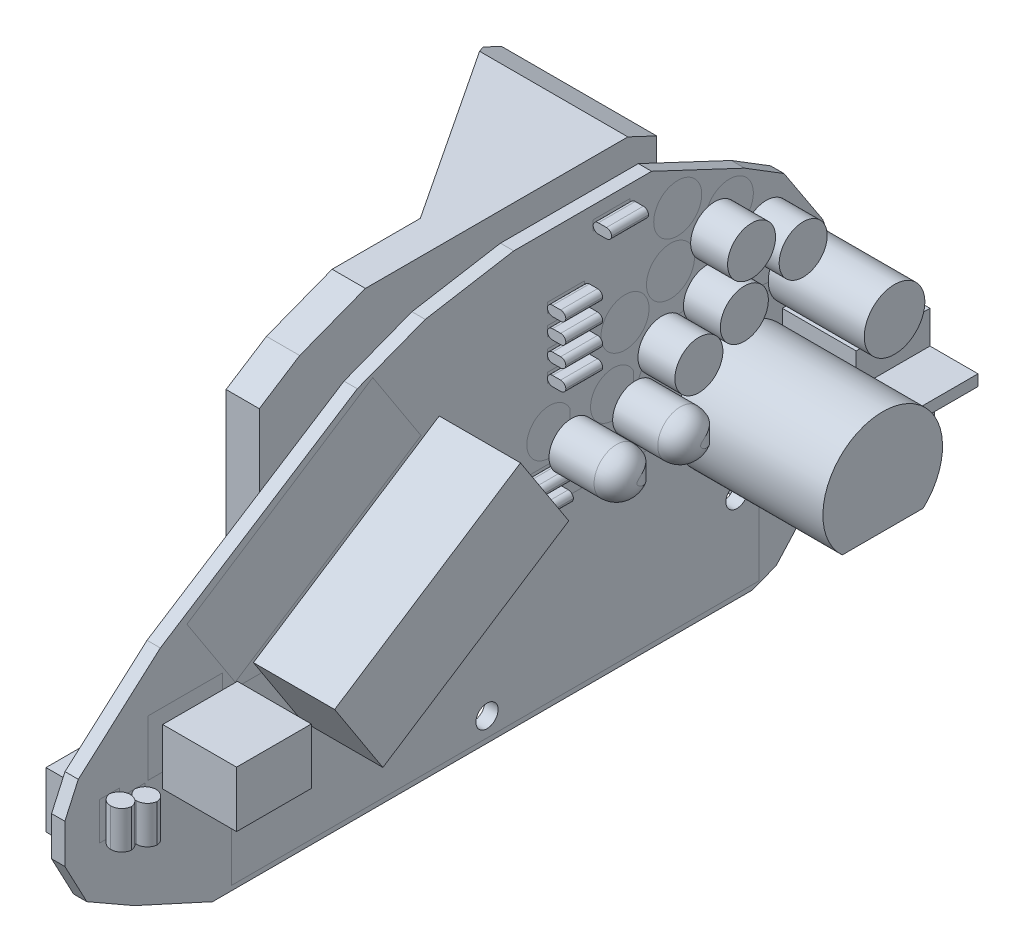
from build123d import *

# Parameters (mm, degrees)
SALIENTE_EXTRUIR1_DEPTH    = 0.9
SALIENTE_EXTRUIR2_START    = 2
CROQUIS7_W                 = 10.12
CROQUIS7_H                 = 7.56
SALIENTE_EXTRUIR2_DEPTH    = 10
SALIENTE_EXTRUIR2_2_DEPTH  = 10
SALIENTE_EXTRUIR3_START    = 9
SALIENTE_EXTRUIR3_DEPTH    = 11
SALIENTE_EXTRUIR4_START    = 5.5
SALIENTE_EXTRUIR4_DEPTH    = 20
SALIENTE_EXTRUIR5_START    = 5
CROQUIS10_R                = 3.25
SALIENTE_EXTRUIR5_DEPTH    = 5
SALIENTE_EXTRUIR5_2_DEPTH  = 5
SALIENTE_EXTRUIR5_3_DEPTH  = 5
SALIENTE_EXTRUIR5_4_DEPTH  = 5
CROQUIS11_W                = 5.2
CROQUIS11_H                = 2.65
SALIENTE_EXTRUIR6_DEPTH    = 3
CROQUIS11_W_2              = 2.66
CROQUIS11_H_2              = 5.11
SALIENTE_EXTRUIR6_2_DEPTH  = 3
SALIENTE_EXTRUIR6_3_DEPTH  = 3
REDONDEO1_R                = 1.5
REDONDEO2_R                = 1.5
REDONDEO3_R                = 1.5
CROQUIS12_W                = 5
CROQUIS12_H                = 1.33
SALIENTE_EXTRUIR7_DEPTH    = 2.5
SALIENTE_EXTRUIR7_2_DEPTH  = 2.5
SALIENTE_EXTRUIR7_3_DEPTH  = 2.5
SALIENTE_EXTRUIR7_4_DEPTH  = 2.5
SALIENTE_EXTRUIR7_5_DEPTH  = 2.5
SALIENTE_EXTRUIR7_6_DEPTH  = 2.5
SALIENTE_EXTRUIR7_7_DEPTH  = 2.5
REDONDEO4_R                = 0.7
REDONDEO5_R                = 0.7
REDONDEO6_R                = 0.7
REDONDEO7_R                = 0.7
REDONDEO8_R                = 0.7
REDONDEO9_R                = 0.7
REDONDEO10_R               = 0.7
SALIENTE_EXTRUIR8_START    = 4
CROQUIS13_R                = 4.1
SALIENTE_EXTRUIR8_DEPTH    = 13
SALIENTE_EXTRUIR9_START    = 3
SALIENTE_EXTRUIR9_DEPTH    = 9
SALIENTE_EXTRUIR9_2_DEPTH  = 9
REDONDEO11_R               = 2.9
REDONDEO12_R               = 2.9
SALIENTE_EXTRUIR10_START   = 3
CROQUIS15_W                = 10
CROQUIS15_H                = 5.9310163
SALIENTE_EXTRUIR10_DEPTH   = 10
CROQUIS16_W                = 10
CROQUIS16_H                = 1.5
SALIENTE_EXTRUIR11_DEPTH   = 6.5
SALIENTE_EXTRUIR12_START   = 2
CROQUIS17_W                = 10.12
CROQUIS17_H                = 7.56
SALIENTE_EXTRUIR12_DEPTH   = 10
CROQUIS17_W_2              = 7.56
CROQUIS17_H_2              = 10.12
SALIENTE_EXTRUIR12_2_DEPTH = 10
SALIENTE_EXTRUIR13_START   = 6
SALIENTE_EXTRUIR13_DEPTH   = 21
CROQUIS19_W                = 51.3
CROQUIS19_H                = 26.88
CORTAR_EXTRUIR1_DEPTH      = 16.5
CORTAR_EXTRUIR2_REACH      = 98.673
CROQUIS21_R                = 1.5
CORTAR_EXTRUIR3_DEPTH      = 1.8


with BuildPart() as part:
    # Croquis4 → Saliente-Extruir1 (new, symmetric)
    with BuildSketch(Plane(origin=(0, 0, 0), x_dir=(0, 0, -1), z_dir=(1, 0, 0))):
        Polygon((-10.622695688, 4.854650468), (0, 0), (73, 0), (76.300834566, 1.236470537), (84.148906627, 9.961535881), (86.8383032, 17.509437242), (86.8383032, 26.919309348), (82.615525059, 38.695458453), (77.368769804, 46.703430489), (72.037005531, 49.99948888), (59.448219357, 55.926364448), (40.78111611, 55.926364448), (28.794561856, 53.88545149), (19.598698434, 50.347904825), (-7.071388362, 33.291671224), (-18.17778841, 23.445194147), (-19.997236925, 19.435512881), (-19.997236925, 14.133503054), (-17.020462883, 8.512686248), align=None)
    extrude(amount=SALIENTE_EXTRUIR1_DEPTH, both=True)

    # Croquis21 → Cortar-Extruir3 (cut)
    with BuildSketch(Plane(origin=(0.9, 0, 0), x_dir=(0, 0, -1), z_dir=(1, 0, 0))):
        with Locations((71.002182534, 12.113092523)):
            Circle(CROQUIS21_R)
        with Locations((37.156321619, 20.626460955)):
            Circle(CROQUIS21_R)
        with Locations((37.156321619, 3.210835321)):
            Circle(CROQUIS21_R)
    extrude(amount=-CORTAR_EXTRUIR3_DEPTH, mode=Mode.SUBTRACT)


with BuildPart() as body_2:
    # Croquis7 → Saliente-Extruir2 (new body)
    with BuildSketch(Plane(origin=(0.9, 0, 0), x_dir=(0, 0, -1), z_dir=(1, 0, 0)).offset(SALIENTE_EXTRUIR2_START)):
        with Locations((-3.691075077, 22.378139651)):
            Rectangle(CROQUIS7_W, CROQUIS7_H)
    extrude(amount=SALIENTE_EXTRUIR2_DEPTH)


with BuildPart() as body_3:
    # Croquis7 → Saliente-Extruir2 2 (new body)
    with BuildSketch(Plane(origin=(0.9, 0, 0), x_dir=(0, 0, -1), z_dir=(1, 0, 0)).offset(SALIENTE_EXTRUIR2_START)):
        with Locations((80.699165068, 23.307910616)):
            Rectangle(CROQUIS7_W, CROQUIS7_H)
    extrude(amount=SALIENTE_EXTRUIR2_2_DEPTH)


with BuildPart() as body_4:
    # Croquis8 → Saliente-Extruir3 (new body)
    with BuildSketch(Plane(origin=(0.9, 0, 0), x_dir=(0, 0, -1), z_dir=(1, 0, 0)).offset(SALIENTE_EXTRUIR3_START)):
        Polygon((21.690282535, 50.615120653), (-3.469834503, 34.275949602), (3.065833917, 24.211902787), (28.225950955, 40.551073837), align=None)
    extrude(amount=SALIENTE_EXTRUIR3_DEPTH)


with BuildPart() as body_5:
    # Croquis9 → Saliente-Extruir4 (new body)
    with BuildSketch(Plane(origin=(0.9, 0, 0), x_dir=(0, 0, -1), z_dir=(1, 0, 0)).offset(SALIENTE_EXTRUIR4_START)):
        with BuildLine():
            Line((59.765445925, 23.529371997), (70.71288421, 23.529371997))
            ThreePointArc((70.71288421, 23.529371997), (65.239165068, 37.6), (59.765445925, 23.529371997))
        make_face()
    extrude(amount=SALIENTE_EXTRUIR4_DEPTH)


with BuildPart() as body_6:
    # Croquis10 → Saliente-Extruir5 (new body)
    with BuildSketch(Plane(origin=(0.9, 0, 0), x_dir=(0, 0, -1), z_dir=(1, 0, 0)).offset(SALIENTE_EXTRUIR5_START)):
        with Locations((55.848753396, 40.009851024)):
            Circle(CROQUIS10_R)
    extrude(amount=SALIENTE_EXTRUIR5_DEPTH)


with BuildPart() as body_7:
    # Croquis10 → Saliente-Extruir5 2 (new body)
    with BuildSketch(Plane(origin=(0.9, 0, 0), x_dir=(0, 0, -1), z_dir=(1, 0, 0)).offset(SALIENTE_EXTRUIR5_START)):
        with Locations((62.005224797, 42.949748612)):
            Circle(CROQUIS10_R)
    extrude(amount=SALIENTE_EXTRUIR5_2_DEPTH)


with BuildPart() as body_8:
    # Croquis10 → Saliente-Extruir5 3 (new body)
    with BuildSketch(Plane(origin=(0.9, 0, 0), x_dir=(0, 0, -1), z_dir=(1, 0, 0)).offset(SALIENTE_EXTRUIR5_START)):
        with Locations((69.970361435, 46.502448257)):
            Circle(CROQUIS10_R)
    extrude(amount=SALIENTE_EXTRUIR5_3_DEPTH)


with BuildPart() as body_9:
    # Croquis10 → Saliente-Extruir5 4 (new body)
    with BuildSketch(Plane(origin=(0.9, 0, 0), x_dir=(0, 0, -1), z_dir=(1, 0, 0)).offset(SALIENTE_EXTRUIR5_START)):
        with Locations((62.9827607, 49.836310956)):
            Circle(CROQUIS10_R)
    extrude(amount=SALIENTE_EXTRUIR5_4_DEPTH)


with BuildPart() as body_10:
    # Croquis11 → Saliente-Extruir6 (new body)
    with BuildSketch(Plane(origin=(0.9, 0, 0), x_dir=(0, 0, -1), z_dir=(1, 0, 0))):
        with Locations((31.478780251, 25.968522268)):
            Rectangle(CROQUIS11_W, CROQUIS11_H)
    extrude(amount=SALIENTE_EXTRUIR6_DEPTH)

    # Redondeo3
    # the kernel refuses this fillet: 1.5 mm, written as the material it takes off along each edge
    with BuildSketch(Plane(origin=(0.9, 27.293522268, -37.828780251), x_dir=(1, 0, 0), z_dir=(0, 0, 1)), Plane(origin=(0.9, 24.643522268, -25.128780251), x_dir=(1, 0, 0), z_dir=(0, 0, -1))) as redondeo3_piece_1:
        with BuildLine():
            CenterArc((REDONDEO3_R, -REDONDEO3_R), REDONDEO3_R, 90, 90)
            Line((0, -REDONDEO3_R), (0, 0))
            Line((0, 0), (REDONDEO3_R, 0))
        make_face()
    extrude(amount=12.7, mode=Mode.SUBTRACT)
    with BuildSketch(Plane(origin=(3.9, 24.643522268, -25.128780251), x_dir=(-1, 0, 0), z_dir=(0, 0, -1)), Plane(origin=(3.9, 27.293522268, -37.828780251), x_dir=(-1, 0, 0), z_dir=(0, 0, 1))) as redondeo3_piece_2:
        with BuildLine():
            CenterArc((REDONDEO3_R, REDONDEO3_R), REDONDEO3_R, 180, 90)
            Line((0, REDONDEO3_R), (0, 0))
            Line((0, 0), (REDONDEO3_R, 0))
        make_face()
    extrude(amount=12.7, mode=Mode.SUBTRACT)


with BuildPart() as body_11:
    # Croquis11 → Saliente-Extruir6 2 (new body)
    with BuildSketch(Plane(origin=(0.9, 0, 0), x_dir=(0, 0, -1), z_dir=(1, 0, 0))):
        with Locations((-10.47860596, 15.944294372)):
            Rectangle(CROQUIS11_W_2, CROQUIS11_H_2)
    extrude(amount=SALIENTE_EXTRUIR6_2_DEPTH)

    # Redondeo2
    # the kernel refuses this fillet: 1.5 mm, written as the material it takes off along each edge
    with BuildSketch(Plane(origin=(0.9, 22.249294372, 11.80860596), x_dir=(1, 0, 0), z_dir=(0, -1, 0)), Plane(origin=(0.9, 9.639294372, 9.14860596), x_dir=(1, 0, 0), z_dir=(0, 1, 0))) as redondeo2_piece_1:
        with BuildLine():
            CenterArc((REDONDEO2_R, -REDONDEO2_R), REDONDEO2_R, 90, 90)
            Line((0, -REDONDEO2_R), (0, 0))
            Line((0, 0), (REDONDEO2_R, 0))
        make_face()
    extrude(amount=12.61, mode=Mode.SUBTRACT)
    with BuildSketch(Plane(origin=(3.9, 9.639294372, 9.14860596), x_dir=(-1, 0, 0), z_dir=(0, 1, 0)), Plane(origin=(3.9, 22.249294372, 11.80860596), x_dir=(-1, 0, 0), z_dir=(0, -1, 0))) as redondeo2_piece_2:
        with BuildLine():
            CenterArc((REDONDEO2_R, REDONDEO2_R), REDONDEO2_R, 180, 90)
            Line((0, REDONDEO2_R), (0, 0))
            Line((0, 0), (REDONDEO2_R, 0))
        make_face()
    extrude(amount=12.61, mode=Mode.SUBTRACT)


with BuildPart() as body_12:
    # Croquis11 → Saliente-Extruir6 3 (new body)
    with BuildSketch(Plane(origin=(0.9, 0, 0), x_dir=(0, 0, -1), z_dir=(1, 0, 0))):
        with Locations((-13.960747503, 17.082754592)):
            Rectangle(CROQUIS11_W_2, CROQUIS11_H_2)
    extrude(amount=SALIENTE_EXTRUIR6_3_DEPTH)

    # Redondeo1
    # the kernel refuses this fillet: 1.5 mm, written as the material it takes off along each edge
    with BuildSketch(Plane(origin=(3.9, 10.777754592, 12.630747503), x_dir=(-1, 0, 0), z_dir=(0, 1, 0)), Plane(origin=(3.9, 23.387754592, 15.290747503), x_dir=(-1, 0, 0), z_dir=(0, -1, 0))) as redondeo1_piece_1:
        with BuildLine():
            CenterArc((REDONDEO1_R, REDONDEO1_R), REDONDEO1_R, 180, 90)
            Line((0, REDONDEO1_R), (0, 0))
            Line((0, 0), (REDONDEO1_R, 0))
        make_face()
    extrude(amount=12.61, mode=Mode.SUBTRACT)
    with BuildSketch(Plane(origin=(0.9, 10.777754592, 12.630747503), x_dir=(1, 0, 0), z_dir=(0, 1, 0)), Plane(origin=(0.9, 23.387754592, 15.290747503), x_dir=(1, 0, 0), z_dir=(0, -1, 0))) as redondeo1_piece_2:
        with BuildLine():
            CenterArc((REDONDEO1_R, -REDONDEO1_R), REDONDEO1_R, 90, 90)
            Line((0, -REDONDEO1_R), (0, 0))
            Line((0, 0), (REDONDEO1_R, 0))
        make_face()
    extrude(amount=12.61, mode=Mode.SUBTRACT)


with BuildPart() as body_13:
    # Croquis12 → Saliente-Extruir7 (new body)
    with BuildSketch(Plane(origin=(0.9, 0, 0), x_dir=(0, 0, -1), z_dir=(1, 0, 0))):
        with Locations((43.860652231, 25.354371997)):
            Rectangle(CROQUIS12_W, CROQUIS12_H)
    extrude(amount=SALIENTE_EXTRUIR7_DEPTH)

    # Redondeo5
    # the kernel refuses this fillet: 0.7 mm, written as the material it takes off along each edge
    with BuildSketch(Plane(origin=(0.9, 24.689371997, -39.610652231), x_dir=(1, 0, 0), z_dir=(0, 0, -1)), Plane(origin=(0.9, 26.019371997, -48.110652231), x_dir=(1, 0, 0), z_dir=(0, 0, 1))) as redondeo5_piece_1:
        with BuildLine():
            CenterArc((REDONDEO5_R, -REDONDEO5_R), REDONDEO5_R, 90, 90)
            Line((0, -REDONDEO5_R), (0, 0))
            Line((0, 0), (REDONDEO5_R, 0))
        make_face()
    extrude(amount=8.5, mode=Mode.SUBTRACT)
    with BuildSketch(Plane(origin=(3.4, 24.689371997, -39.610652231), x_dir=(-1, 0, 0), z_dir=(0, 0, -1)), Plane(origin=(3.4, 26.019371997, -48.110652231), x_dir=(-1, 0, 0), z_dir=(0, 0, 1))) as redondeo5_piece_2:
        with BuildLine():
            CenterArc((REDONDEO5_R, REDONDEO5_R), REDONDEO5_R, 180, 90)
            Line((0, REDONDEO5_R), (0, 0))
            Line((0, 0), (REDONDEO5_R, 0))
        make_face()
    extrude(amount=8.5, mode=Mode.SUBTRACT)


with BuildPart() as body_14:
    # Croquis12 → Saliente-Extruir7 2 (new body)
    with BuildSketch(Plane(origin=(0.9, 0, 0), x_dir=(0, 0, -1), z_dir=(1, 0, 0))):
        with Locations((43.860652231, 27.904371997)):
            Rectangle(CROQUIS12_W, CROQUIS12_H)
    extrude(amount=SALIENTE_EXTRUIR7_2_DEPTH)

    # Redondeo4
    # the kernel refuses this fillet: 0.7 mm, written as the material it takes off along each edge
    with BuildSketch(Plane(origin=(0.9, 28.569371997, -48.110652231), x_dir=(1, 0, 0), z_dir=(0, 0, 1)), Plane(origin=(0.9, 27.239371997, -39.610652231), x_dir=(1, 0, 0), z_dir=(0, 0, -1))) as redondeo4_piece_1:
        with BuildLine():
            CenterArc((REDONDEO4_R, -REDONDEO4_R), REDONDEO4_R, 90, 90)
            Line((0, -REDONDEO4_R), (0, 0))
            Line((0, 0), (REDONDEO4_R, 0))
        make_face()
    extrude(amount=8.5, mode=Mode.SUBTRACT)
    with BuildSketch(Plane(origin=(3.4, 28.569371997, -48.110652231), x_dir=(-1, 0, 0), z_dir=(0, 0, 1)), Plane(origin=(3.4, 27.239371997, -39.610652231), x_dir=(-1, 0, 0), z_dir=(0, 0, -1))) as redondeo4_piece_2:
        with BuildLine():
            CenterArc((REDONDEO4_R, REDONDEO4_R), REDONDEO4_R, 180, 90)
            Line((0, REDONDEO4_R), (0, 0))
            Line((0, 0), (REDONDEO4_R, 0))
        make_face()
    extrude(amount=8.5, mode=Mode.SUBTRACT)


with BuildPart() as body_15:
    # Croquis12 → Saliente-Extruir7 3 (new body)
    with BuildSketch(Plane(origin=(0.9, 0, 0), x_dir=(0, 0, -1), z_dir=(1, 0, 0))):
        with Locations((47.829608022, 38.738836043)):
            Rectangle(CROQUIS12_W, CROQUIS12_H)
    extrude(amount=SALIENTE_EXTRUIR7_3_DEPTH)

    # Redondeo6
    # the kernel refuses this fillet: 0.7 mm, written as the material it takes off along each edge
    with BuildSketch(Plane(origin=(0.9, 39.403836043, -52.079608022), x_dir=(1, 0, 0), z_dir=(0, 0, 1)), Plane(origin=(0.9, 38.073836043, -43.579608022), x_dir=(1, 0, 0), z_dir=(0, 0, -1))) as redondeo6_piece_1:
        with BuildLine():
            CenterArc((REDONDEO6_R, -REDONDEO6_R), REDONDEO6_R, 90, 90)
            Line((0, -REDONDEO6_R), (0, 0))
            Line((0, 0), (REDONDEO6_R, 0))
        make_face()
    extrude(amount=8.5, mode=Mode.SUBTRACT)
    with BuildSketch(Plane(origin=(3.4, 39.403836043, -52.079608022), x_dir=(-1, 0, 0), z_dir=(0, 0, 1)), Plane(origin=(3.4, 38.073836043, -43.579608022), x_dir=(-1, 0, 0), z_dir=(0, 0, -1))) as redondeo6_piece_2:
        with BuildLine():
            CenterArc((REDONDEO6_R, REDONDEO6_R), REDONDEO6_R, 180, 90)
            Line((0, REDONDEO6_R), (0, 0))
            Line((0, 0), (REDONDEO6_R, 0))
        make_face()
    extrude(amount=8.5, mode=Mode.SUBTRACT)


with BuildPart() as body_16:
    # Croquis12 → Saliente-Extruir7 4 (new body)
    with BuildSketch(Plane(origin=(0.9, 0, 0), x_dir=(0, 0, -1), z_dir=(1, 0, 0))):
        with Locations((47.829608022, 41.478836043)):
            Rectangle(CROQUIS12_W, CROQUIS12_H)
    extrude(amount=SALIENTE_EXTRUIR7_4_DEPTH)

    # Redondeo7
    # the kernel refuses this fillet: 0.7 mm, written as the material it takes off along each edge
    with BuildSketch(Plane(origin=(0.9, 40.813836043, -43.579608022), x_dir=(1, 0, 0), z_dir=(0, 0, -1)), Plane(origin=(0.9, 42.143836043, -52.079608022), x_dir=(1, 0, 0), z_dir=(0, 0, 1))) as redondeo7_piece_1:
        with BuildLine():
            CenterArc((REDONDEO7_R, -REDONDEO7_R), REDONDEO7_R, 90, 90)
            Line((0, -REDONDEO7_R), (0, 0))
            Line((0, 0), (REDONDEO7_R, 0))
        make_face()
    extrude(amount=8.5, mode=Mode.SUBTRACT)
    with BuildSketch(Plane(origin=(3.4, 42.143836043, -52.079608022), x_dir=(-1, 0, 0), z_dir=(0, 0, 1)), Plane(origin=(3.4, 40.813836043, -43.579608022), x_dir=(-1, 0, 0), z_dir=(0, 0, -1))) as redondeo7_piece_2:
        with BuildLine():
            CenterArc((REDONDEO7_R, REDONDEO7_R), REDONDEO7_R, 180, 90)
            Line((0, REDONDEO7_R), (0, 0))
            Line((0, 0), (REDONDEO7_R, 0))
        make_face()
    extrude(amount=8.5, mode=Mode.SUBTRACT)


with BuildPart() as body_17:
    # Croquis12 → Saliente-Extruir7 5 (new body)
    with BuildSketch(Plane(origin=(0.9, 0, 0), x_dir=(0, 0, -1), z_dir=(1, 0, 0))):
        with Locations((47.829608022, 44.218836043)):
            Rectangle(CROQUIS12_W, CROQUIS12_H)
    extrude(amount=SALIENTE_EXTRUIR7_5_DEPTH)

    # Redondeo8
    # the kernel refuses this fillet: 0.7 mm, written as the material it takes off along each edge
    with BuildSketch(Plane(origin=(0.9, 44.883836043, -52.079608022), x_dir=(1, 0, 0), z_dir=(0, 0, 1)), Plane(origin=(0.9, 43.553836043, -43.579608022), x_dir=(1, 0, 0), z_dir=(0, 0, -1))) as redondeo8_piece_1:
        with BuildLine():
            CenterArc((REDONDEO8_R, -REDONDEO8_R), REDONDEO8_R, 90, 90)
            Line((0, -REDONDEO8_R), (0, 0))
            Line((0, 0), (REDONDEO8_R, 0))
        make_face()
    extrude(amount=8.5, mode=Mode.SUBTRACT)
    with BuildSketch(Plane(origin=(3.4, 44.883836043, -52.079608022), x_dir=(-1, 0, 0), z_dir=(0, 0, 1)), Plane(origin=(3.4, 43.553836043, -43.579608022), x_dir=(-1, 0, 0), z_dir=(0, 0, -1))) as redondeo8_piece_2:
        with BuildLine():
            CenterArc((REDONDEO8_R, REDONDEO8_R), REDONDEO8_R, 180, 90)
            Line((0, REDONDEO8_R), (0, 0))
            Line((0, 0), (REDONDEO8_R, 0))
        make_face()
    extrude(amount=8.5, mode=Mode.SUBTRACT)


with BuildPart() as body_18:
    # Croquis12 → Saliente-Extruir7 6 (new body)
    with BuildSketch(Plane(origin=(0.9, 0, 0), x_dir=(0, 0, -1), z_dir=(1, 0, 0))):
        with Locations((47.829608022, 46.958836043)):
            Rectangle(CROQUIS12_W, CROQUIS12_H)
    extrude(amount=SALIENTE_EXTRUIR7_6_DEPTH)

    # Redondeo9
    # the kernel refuses this fillet: 0.7 mm, written as the material it takes off along each edge
    with BuildSketch(Plane(origin=(0.9, 46.293836043, -43.579608022), x_dir=(1, 0, 0), z_dir=(0, 0, -1)), Plane(origin=(0.9, 47.623836043, -52.079608022), x_dir=(1, 0, 0), z_dir=(0, 0, 1))) as redondeo9_piece_1:
        with BuildLine():
            CenterArc((REDONDEO9_R, -REDONDEO9_R), REDONDEO9_R, 90, 90)
            Line((0, -REDONDEO9_R), (0, 0))
            Line((0, 0), (REDONDEO9_R, 0))
        make_face()
    extrude(amount=8.5, mode=Mode.SUBTRACT)
    with BuildSketch(Plane(origin=(3.4, 47.623836043, -52.079608022), x_dir=(-1, 0, 0), z_dir=(0, 0, 1)), Plane(origin=(3.4, 46.293836043, -43.579608022), x_dir=(-1, 0, 0), z_dir=(0, 0, -1))) as redondeo9_piece_2:
        with BuildLine():
            CenterArc((REDONDEO9_R, REDONDEO9_R), REDONDEO9_R, 180, 90)
            Line((0, REDONDEO9_R), (0, 0))
            Line((0, 0), (REDONDEO9_R, 0))
        make_face()
    extrude(amount=8.5, mode=Mode.SUBTRACT)


with BuildPart() as body_19:
    # Croquis12 → Saliente-Extruir7 7 (new body)
    with BuildSketch(Plane(origin=(0.9, 0, 0), x_dir=(0, 0, -1), z_dir=(1, 0, 0))):
        with Locations((54.029608022, 53.528836043)):
            Rectangle(CROQUIS12_W, CROQUIS12_H)
    extrude(amount=SALIENTE_EXTRUIR7_7_DEPTH)

    # Redondeo10
    # the kernel refuses this fillet: 0.7 mm, written as the material it takes off along each edge
    with BuildSketch(Plane(origin=(0.9, 54.193836043, -58.279608022), x_dir=(1, 0, 0), z_dir=(0, 0, 1)), Plane(origin=(0.9, 52.863836043, -49.779608022), x_dir=(1, 0, 0), z_dir=(0, 0, -1))) as redondeo10_piece_1:
        with BuildLine():
            CenterArc((REDONDEO10_R, -REDONDEO10_R), REDONDEO10_R, 90, 90)
            Line((0, -REDONDEO10_R), (0, 0))
            Line((0, 0), (REDONDEO10_R, 0))
        make_face()
    extrude(amount=8.5, mode=Mode.SUBTRACT)
    with BuildSketch(Plane(origin=(3.4, 52.863836043, -49.779608022), x_dir=(-1, 0, 0), z_dir=(0, 0, -1)), Plane(origin=(3.4, 54.193836043, -58.279608022), x_dir=(-1, 0, 0), z_dir=(0, 0, 1))) as redondeo10_piece_2:
        with BuildLine():
            CenterArc((REDONDEO10_R, REDONDEO10_R), REDONDEO10_R, 180, 90)
            Line((0, REDONDEO10_R), (0, 0))
            Line((0, 0), (REDONDEO10_R, 0))
        make_face()
    extrude(amount=8.5, mode=Mode.SUBTRACT)


with BuildPart() as body_20:
    # Croquis13 → Saliente-Extruir8 (new body)
    with BuildSketch(Plane(origin=(0.9, 0, 0), x_dir=(0, 0, -1), z_dir=(1, 0, 0)).offset(SALIENTE_EXTRUIR8_START)):
        with Locations(Location((75.339165068, 39.118926916, 0), (0, 0, 180))):
            Circle(CROQUIS13_R)
    extrude(amount=SALIENTE_EXTRUIR8_DEPTH)


with BuildPart() as body_21:
    # Croquis14 → Saliente-Extruir9 (new body)
    with BuildSketch(Plane(origin=(0.9, 0, 0), x_dir=(0, 0, -1), z_dir=(1, 0, 0)).offset(SALIENTE_EXTRUIR9_START)):
        with BuildLine():
            Line((56.985865249, 31.012449991), (56.985865249, 33.78178204))
            ThreePointArc((56.985865249, 33.78178204), (51.175865249, 32.397116016), (56.985865249, 31.012449991))
        make_face()
    extrude(amount=SALIENTE_EXTRUIR9_DEPTH)

    # Redondeo12
    # the kernel refuses this fillet: 2.9 mm, written as the material it takes off along each edge
    with BuildSketch(Plane(origin=(12.9, 32.397116016, -54.245865249), x_dir=(0, 0.003141587485880861, -0.9999950652018581), z_dir=(0, -0.9999950652018581, -0.003141587485880861))) as redondeo12_piece_1:
        with BuildLine():
            CenterArc((3.07 - REDONDEO12_R, -REDONDEO12_R), REDONDEO12_R, 0, 90)
            Line((3.07 - REDONDEO12_R, 0), (3.07, 0))
            Line((3.07, 0), (3.07, -REDONDEO12_R))
        make_face()
    revolve(axis=Axis((12.9, 32.397116016, -54.245865249), (1, 0, 0)), revolution_arc=359.64, mode=Mode.SUBTRACT)
    with BuildSketch(Plane(origin=(12.9, 23.762449991, -56.985865249), x_dir=(-1, 0, 0), z_dir=(0, 1, 0))) as redondeo12_piece_2:
        with BuildLine():
            CenterArc((REDONDEO12_R, REDONDEO12_R), REDONDEO12_R, 180, 90)
            Line((0, REDONDEO12_R), (0, 0))
            Line((0, 0), (REDONDEO12_R, 0))
        make_face()
    extrude(amount=17.269332049, mode=Mode.SUBTRACT)


with BuildPart() as body_22:
    # Croquis14 → Saliente-Extruir9 2 (new body)
    with BuildSketch(Plane(origin=(0.9, 0, 0), x_dir=(0, 0, -1), z_dir=(1, 0, 0)).offset(SALIENTE_EXTRUIR9_START)):
        with BuildLine():
            Line((48.364883345, 30.915019131), (48.364883345, 33.684351181))
            ThreePointArc((48.364883345, 33.684351181), (42.554883345, 32.299685156), (48.364883345, 30.915019131))
        make_face()
    extrude(amount=SALIENTE_EXTRUIR9_2_DEPTH)

    # Redondeo11
    # the kernel refuses this fillet: 2.9 mm, written as the material it takes off along each edge
    with BuildSketch(Plane(origin=(12.9, 32.299685156, -45.624883345), x_dir=(0, 0.003141587485880854, -0.9999950652018582), z_dir=(0, -0.9999950652018582, -0.003141587485880854))) as redondeo11_piece_1:
        with BuildLine():
            CenterArc((3.07 - REDONDEO11_R, -REDONDEO11_R), REDONDEO11_R, 0, 90)
            Line((3.07 - REDONDEO11_R, 0), (3.07, 0))
            Line((3.07, 0), (3.07, -REDONDEO11_R))
        make_face()
    revolve(axis=Axis((12.9, 32.299685156, -45.624883345), (1, 0, 0)), revolution_arc=359.64, mode=Mode.SUBTRACT)
    with BuildSketch(Plane(origin=(12.9, 23.665019131, -48.364883345), x_dir=(-1, 0, 0), z_dir=(0, 1, 0))) as redondeo11_piece_2:
        with BuildLine():
            CenterArc((REDONDEO11_R, REDONDEO11_R), REDONDEO11_R, 180, 90)
            Line((0, REDONDEO11_R), (0, 0))
            Line((0, 0), (REDONDEO11_R, 0))
        make_face()
    extrude(amount=17.269332049, mode=Mode.SUBTRACT)


with BuildPart() as body_23:
    # Croquis15 → Saliente-Extruir10 (new body)
    with BuildSketch(Plane(origin=(0.9, 0, 0), x_dir=(0, 0, -1), z_dir=(1, 0, 0)).offset(SALIENTE_EXTRUIR10_START)):
        with Locations((79.139165068, 31.053418766)):
            Rectangle(CROQUIS15_W, CROQUIS15_H)
    extrude(amount=SALIENTE_EXTRUIR10_DEPTH)


with BuildPart() as body_24:
    # Croquis16 → Saliente-Extruir11 (new body)
    with BuildSketch(Plane(origin=(13.9, 0, 0), x_dir=(0, 0, -1), z_dir=(1, 0, 0))):
        with Locations((79.139165068, 28.837910616)):
            Rectangle(CROQUIS16_W, CROQUIS16_H)
    extrude(amount=SALIENTE_EXTRUIR11_DEPTH)


with BuildPart() as body_25:
    # Croquis17 → Saliente-Extruir12 (new body)
    with BuildSketch(Plane.ZY.offset(0.9).offset(SALIENTE_EXTRUIR12_START)):
        with Locations((3.691075077, 9.431551618)):
            Rectangle(CROQUIS17_W, CROQUIS17_H)
    extrude(amount=SALIENTE_EXTRUIR12_DEPTH)


with BuildPart() as body_26:
    # Croquis17 → Saliente-Extruir12 2 (new body)
    with BuildSketch(Plane.ZY.offset(0.9).offset(SALIENTE_EXTRUIR12_START)):
        with Locations((-78.194790383, 13.446507381)):
            Rectangle(CROQUIS17_W_2, CROQUIS17_H_2)
    extrude(amount=SALIENTE_EXTRUIR12_2_DEPTH)


with BuildPart() as body_27:
    # Croquis18 → Saliente-Extruir13 (new body)
    with BuildSketch(Plane.ZY.offset(0.9).offset(SALIENTE_EXTRUIR13_START)):
        Polygon((-67.93, 51.933091565), (-67.93, 23.889371997), (-14.13, 23.889371997), (-14.13, 46.850525956), (-19.598698434, 50.347904825), (-28.492812857, 53.769371997), (-64.029708614, 53.769371997), align=None)
    extrude(amount=SALIENTE_EXTRUIR13_DEPTH)

    # Croquis19 → Cortar-Extruir1 (cut)
    with BuildSketch(Plane.ZY.offset(27.9)):
        with Locations((-39.78, 38.829371997)):
            Rectangle(CROQUIS19_W, CROQUIS19_H)
    extrude(amount=-CORTAR_EXTRUIR1_DEPTH, mode=Mode.SUBTRACT)

    # Cortar-Extruir2: up to this face of the body (flat: up to its plane)
    cortar_extruir2_end = Plane(body_27.part.faces().sort_by_distance((-17.4, 53.769371997, -46.261260736))[0])
    # Croquis20 → Cortar-Extruir2 (cut, up to the picked face)
    with BuildSketch(Plane.XZ.offset(-23.889371997), mode=Mode.PRIVATE) as cortar_extruir2_sk1:
        Polygon((-27.9, -65.43), (-30.395508279, -65.43), (-30.395508279, -11.991970843), (-11.4, -11.991970843), (-11.4, -40.43), align=None)
    cortar_extruir2_tool1 = split(extrude(cortar_extruir2_sk1.sketch, amount=-CORTAR_EXTRUIR2_REACH, mode=Mode.PRIVATE), bisect_by=cortar_extruir2_end, keep=Keep.BOTH, mode=Mode.PRIVATE)
    add(cortar_extruir2_tool1.solids().sort_by(Axis((-21.91717, 23.889372, -34.022689), (0, 1, 0)))[0], mode=Mode.SUBTRACT)


solid = Compound([part.part, body_2.part, body_3.part, body_4.part, body_5.part, body_6.part, body_7.part, body_8.part, body_9.part, body_10.part, body_11.part, body_12.part, body_13.part, body_14.part, body_15.part, body_16.part, body_17.part, body_18.part, body_19.part, body_20.part, body_21.part, body_22.part, body_23.part, body_24.part, body_25.part, body_26.part, body_27.part])
